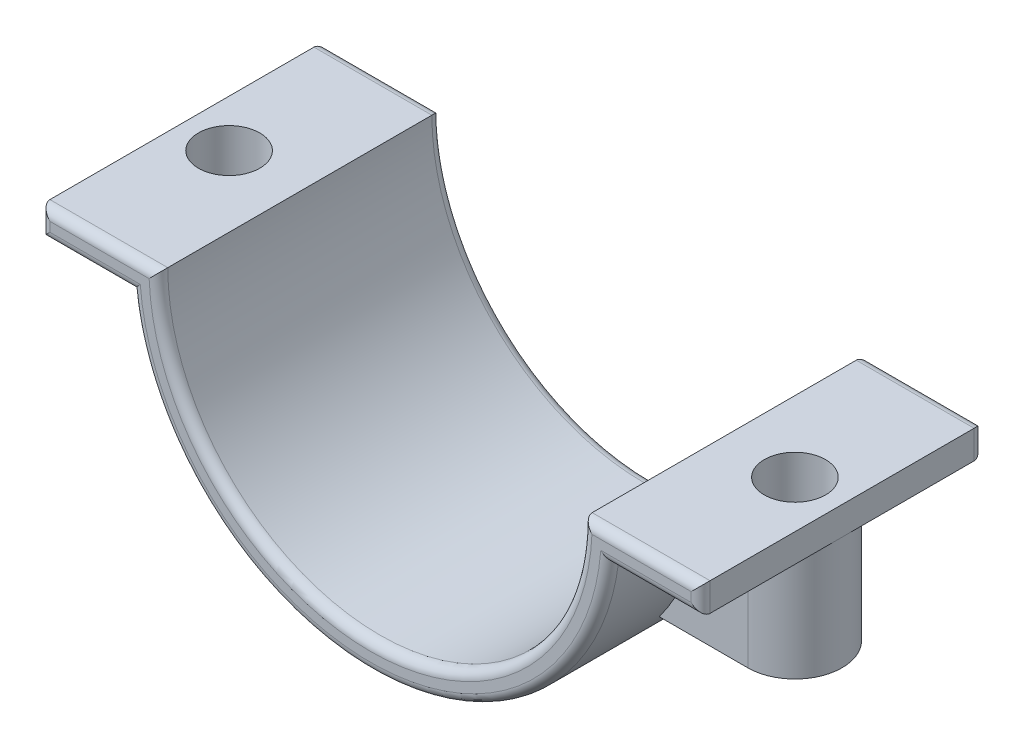
from build123d import *

# Parameters (mm, degrees)
BOSS_EXTRUDE1_DEPTH = 15
BOSS_EXTRUDE2_REACH = 58.23
BOSS_EXTRUDE2_START = 12
SKETCH2_R           = 3.25
SKETCH2_3_R         = 3.25
CUT_EXTRUDE1_DEPTH  = 45.229515032
FILLET1_R           = 1


with BuildPart() as part:
    # Sketch1 → Boss-Extrude1 (new, symmetric)
    with BuildSketch(Plane.XY):
        with BuildLine():
            Line((-35, 0), (-22.5, 0))
            ThreePointArc((-22.5, 0), (0, -22.5), (22.5, 0))
            Line((22.5, 0), (35, 0))
            Line((35, 0), (35, -3))
            Line((35, -3), (25.322914524, -3))
            ThreePointArc((25.322914524, -3), (0, -25.5), (-25.322914524, -3))
            Line((-25.322914524, -3), (-35, -3))
            Line((-35, -3), (-35, 0))
        make_face()
    extrude(amount=BOSS_EXTRUDE1_DEPTH, both=True)

    # Sketch2 → Boss-Extrude2 (add, up to next)
    with BuildSketch(Plane.XZ.offset(3).offset(BOSS_EXTRUDE2_START), mode=Mode.PRIVATE) as boss_extrude2_sk1:
        with BuildLine():
            Line((18, 5), (18, -5))
            Line((18, -5), (30, -5))
            ThreePointArc((30, -5), (35, 0), (30, 5))
            Line((30, 5), (18, 5))
        make_face()
        with Locations((30, 0)):
            Circle(SKETCH2_R, mode=Mode.SUBTRACT)
    boss_extrude2_tool1 = extrude(boss_extrude2_sk1.sketch, amount=-BOSS_EXTRUDE2_REACH, mode=Mode.PRIVATE) - part.part
    boss_extrude2 = boss_extrude2_tool1.solids().sort_by_distance((24.95057, -15, 0))[0]
    add(boss_extrude2)

    # Sketch2<3> → Cut-Extrude1 (cut, through all)
    with BuildSketch(Plane.XZ.offset(3)):
        with Locations((30, 0)):
            Circle(SKETCH2_3_R)
    cut_extrude1 = extrude(amount=-CUT_EXTRUDE1_DEPTH, mode=Mode.SUBTRACT)

    # Mirror1: Boss-Extrude2, Cut-Extrude1 across plane
    add(boss_extrude2.mirror(Plane(origin=(0, 0, 0), x_dir=(0, 0, 1), z_dir=(1, 0, 0))))
    add(cut_extrude1.mirror(Plane(origin=(0, 0, 0), x_dir=(0, 0, 1), z_dir=(1, 0, 0))), mode=Mode.SUBTRACT)

    # Fillet1
    fillet1_edges = [part.edges().sort_by_distance(p)[0] for p in [
        (-30.161457262, -3, -15),
        (0, -25.5, -15),
        (30.161457262, -3, -15),
        (35, -1.5, -15),
        (28.75, 0, -15),
        (0, -22.5, -15),
        (-28.75, 0, -15),
        (-35, -1.5, -15),
        (-28.75, 0, 15),
        (0, -22.5, 15),
        (28.75, 0, 15),
        (35, -1.5, 15),
        (30.161457262, -3, 15),
        (0, -25.5, 15),
        (-30.161457262, -3, 15),
        (-35, -1.5, 15),
    ]]
    fillet(fillet1_edges, radius=FILLET1_R)


solid = part.part
